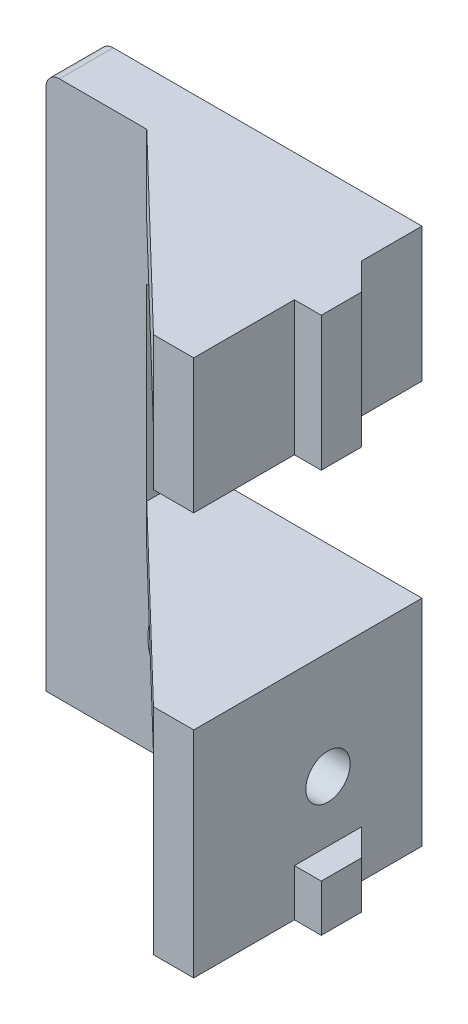
from build123d import *

# Parameters (mm, degrees)
SKETCH1_W               = 24
SKETCH1_H               = 40
BOSS_EXTRUDE1_DEPTH     = 4
FILLET1_R               = 1
CUT_EXTRUDE2_DEPTH      = 43.860474698
CUT_EXTRUDE2_DEPTH_BACK = 43.860474698
SKETCH3_W               = 16.5
SKETCH3_H               = 14
SKETCH5_W               = 3
SKETCH5_H               = 16
BOSS_EXTRUDE2_DEPTH     = 13
BOSS_EXTRUDE3_DEPTH     = 3
BOSS_EXTRUDE4_DEPTH     = 3
SKETCH8_R               = 1.65
CUT_EXTRUDE4_DEPTH      = 3
SKETCH9_W               = 3
SKETCH9_H               = 10
BOSS_EXTRUDE5_DEPTH     = 13
BOSS_EXTRUDE6_DEPTH     = 6
SKETCH11_W              = 5
SKETCH11_H              = 10
BOSS_EXTRUDE7_DEPTH     = 2
CHAMFER1_SIZE           = 2
SKETCH12_R              = 3.1
CUT_EXTRUDE5_DEPTH      = 3.1
SKETCH17_R              = 4
BOSS_EXTRUDE8_DEPTH     = 1
FILLET3_R               = 1
SKETCH21_R              = 2.25
BOSS_EXTRUDE11_DEPTH    = 2.9
SKETCH23_W              = 5
SKETCH23_H              = 3.5
BOSS_EXTRUDE12_DEPTH    = 2
CHAMFER2_SIZE           = 2
FILLET6_R               = 0.5
SKETCH24_R              = 1.25
CUT_EXTRUDE6_DEPTH      = 2.5
FILLET7_R               = 0.5


with BuildPart() as part:
    # Sketch1 → Boss-Extrude1 (new body)
    with BuildSketch(Plane.XY):
        with Locations((-14.758064516, 13.241935484)):
            Rectangle(SKETCH1_W, SKETCH1_H)
    extrude(amount=BOSS_EXTRUDE1_DEPTH)

    # Fillet1
    fillet1_edges = [part.edges().sort_by_distance(p)[0] for p in [
        (-26.758064516, 33.241935484, 2),
    ]]
    fillet(fillet1_edges, radius=FILLET1_R)

    # Sketch3 → Cut-Extrude2 (cut, two sides: drawn at the far end of the back side and taken through both)
    with BuildSketch(Plane(origin=(0, 0, 0), x_dir=(-1, 0, 0), z_dir=(0, 0, -1)).offset(-CUT_EXTRUDE2_DEPTH_BACK)):
        with Locations((11.008064516, 16.241935484)):
            Rectangle(SKETCH3_W, SKETCH3_H)
    extrude(amount=CUT_EXTRUDE2_DEPTH + CUT_EXTRUDE2_DEPTH_BACK, mode=Mode.SUBTRACT)

    # Sketch5 → Boss-Extrude2 (add)
    with BuildSketch(Plane.XY.offset(4)):
        with Locations((-4.258064516, 1.241935484)):
            Rectangle(SKETCH5_W, SKETCH5_H)
    extrude(amount=BOSS_EXTRUDE2_DEPTH)

    # Sketch6 → Boss-Extrude3 (add)
    with BuildSketch(Plane.XZ.offset(6.758064516)):
        Polygon((-5.758064516, 17), (-16.666359721, 4), (-5.758064516, 4), align=None)
    extrude(amount=-BOSS_EXTRUDE3_DEPTH)

    # Sketch7 → Boss-Extrude4 (add)
    with BuildSketch(Plane(origin=(0, 9.241935484, 0), x_dir=(1, 0, 0), z_dir=(0, 1, 0))):
        Polygon((-5.758064516, -17), (-19.258064516, -4), (-5.758064516, -4), align=None)
    extrude(amount=-BOSS_EXTRUDE4_DEPTH)

    # Sketch8 → Cut-Extrude4 (cut)
    with BuildSketch(Plane.ZY.offset(5.758064516)):
        with Locations(Location((7, 1.241935484, 0), (0, 0, 270))):
            Circle(SKETCH8_R)
    extrude(amount=-CUT_EXTRUDE4_DEPTH, mode=Mode.SUBTRACT)

    # Sketch9 → Boss-Extrude5 (add)
    with BuildSketch(Plane.XY.offset(4)):
        with Locations((-4.258064516, 28.241935484)):
            Rectangle(SKETCH9_W, SKETCH9_H)
    extrude(amount=BOSS_EXTRUDE5_DEPTH)

    # Sketch10 → Boss-Extrude6 (add)
    with BuildSketch(Plane(origin=(0, 33.241935484, 0), x_dir=(1, 0, 0), z_dir=(0, 1, 0))):
        Polygon((-5.758064516, -17), (-19.258064516, -4), (-5.758064516, -4), align=None)
    extrude(amount=-BOSS_EXTRUDE6_DEPTH)

    # Sketch11 → Boss-Extrude7 (add)
    with BuildSketch(Plane(origin=(-2.758064516, 0, 0), x_dir=(0, 0, -1), z_dir=(1, 0, 0))):
        with Locations((-7, 28.241935484)):
            Rectangle(SKETCH11_W, SKETCH11_H)
    extrude(amount=BOSS_EXTRUDE7_DEPTH)

    # Chamfer1
    chamfer1_edges = [part.edges().sort_by_distance(p)[0] for p in [
        (-0.758064516, 28.241935484, 4.5),
    ]]
    chamfer(chamfer1_edges, length=CHAMFER1_SIZE - 0.0001)  # a hair under: the kernel refuses the full size

    # Sketch12 → Cut-Extrude5 (cut)
    with BuildSketch(Plane(origin=(0, 0, 0), x_dir=(-1, 0, 0), z_dir=(0, 0, -1))):
        with Locations((14.758064516, 1.241935484)):
            Circle(SKETCH12_R)
    extrude(amount=-CUT_EXTRUDE5_DEPTH, mode=Mode.SUBTRACT)

    # Sketch17 → Boss-Extrude8 (add)
    with BuildSketch(Plane.XY.offset(4)):
        with Locations((-14.758064516, 1.241935484)):
            Circle(SKETCH17_R)
    extrude(amount=BOSS_EXTRUDE8_DEPTH)

    # Fillet3
    fillet3_edges = [part.edges().sort_by_distance(p)[0] for p in [
        (-18.758064516, 1.241935484, 5),
    ]]
    fillet(fillet3_edges, radius=FILLET3_R - 0.0001)  # a hair under: the kernel refuses the full size

    # Sketch23 → Boss-Extrude12 (add)
    with BuildSketch(Plane(origin=(-2.758064516, 0, 0), x_dir=(0, 0, -1), z_dir=(1, 0, 0))):
        with Locations((-7, -5.008064516)):
            Rectangle(SKETCH23_W, SKETCH23_H)
    extrude(amount=BOSS_EXTRUDE12_DEPTH)

    # Chamfer2
    chamfer2_edges = [part.edges().sort_by_distance(p)[0] for p in [
        (-0.758064516, -5.008064516, 4.5),
    ]]
    chamfer(chamfer2_edges, length=CHAMFER2_SIZE - 0.0001)  # a hair under: the kernel refuses the full size

    # Fillet6
    fillet6_edges = [part.edges().sort_by_distance(p)[0] for p in [
        (-11.658064516, 1.241935484, 0),
    ]]
    fillet(fillet6_edges, radius=FILLET6_R)

    # Sketch24 → Cut-Extrude6 (cut)
    with BuildSketch(Plane(origin=(0, 0, 0), x_dir=(-1, 0, 0), z_dir=(0, 0, -1))):
        with Locations((10.508064516, 25.741935484)):
            Circle(SKETCH24_R)
    extrude(amount=-CUT_EXTRUDE6_DEPTH, mode=Mode.SUBTRACT)

    # Fillet7
    fillet7_edges = [part.edges().sort_by_distance(p)[0] for p in [
        (-9.258064516, 25.741935484, 0),
    ]]
    fillet(fillet7_edges, radius=FILLET7_R)


with BuildPart() as body_2:
    # Sketch21 → Boss-Extrude11 (new body)
    with BuildSketch(Plane(origin=(0, 0, 0), x_dir=(-1, 0, 0), z_dir=(0, 0, -1))):
        with Locations((14.758064516, 1.241935484)):
            Circle(SKETCH21_R)
    extrude(amount=-BOSS_EXTRUDE11_DEPTH)


solid = Compound([part.part, body_2.part])
